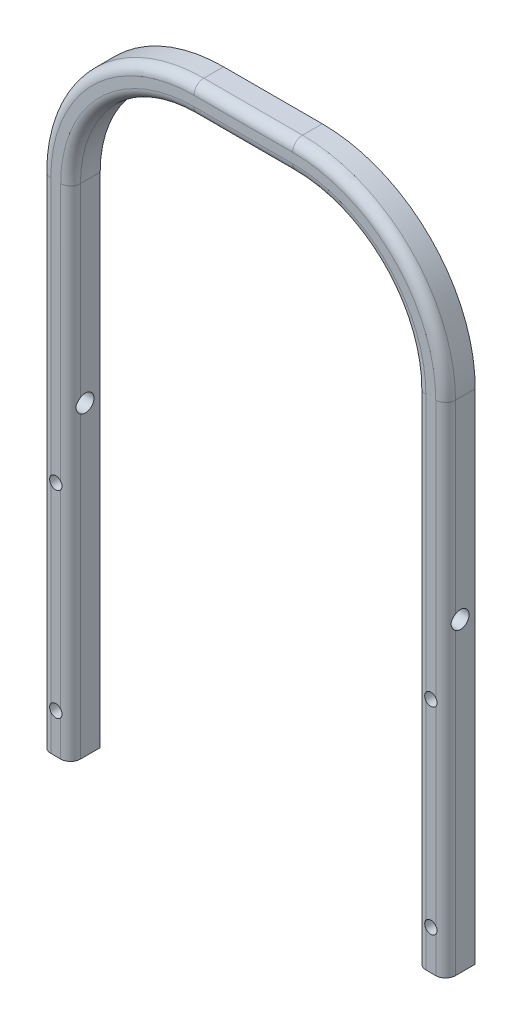
from build123d import *

# Parameters (mm, degrees)
BOSS_EXTRU_1_DEPTH           = 6
ENL_V_MAT_EXTRU_1_DEPTH      = 139.351002888
ENL_V_MAT_EXTRU_1_DEPTH_BACK = 139.351002888
ESQUISSE2_R                  = 1.25
CONG_1_R                     = 25
CONG_2_R                     = 31
CONG_3_R                     = 2
ENL_V_MAT_EXTRU_2_DEPTH      = 156.512057552
ENL_V_MAT_EXTRU_2_DEPTH_BACK = 156.512057552
ESQUISSE3_R                  = 1.75


with BuildPart() as part:
    # Esquisse1 → Boss.-Extru.1 (new body)
    with BuildSketch(Plane.XY):
        Polygon((35, 0), (35, 126), (-35, 126), (-35, 0), (-41, 0), (-41, 132), (41, 132), (41, 0), align=None)
    extrude(amount=BOSS_EXTRU_1_DEPTH)

    # Esquisse2 → Enlèv. mat.-Extru.1 (cut, two sides: drawn at the far end of the back side and taken through both)
    with BuildSketch(Plane.XY.offset(6).offset(-ENL_V_MAT_EXTRU_1_DEPTH_BACK)):
        with Locations((-38, 48)):
            Circle(ESQUISSE2_R)
        with Locations((-38, 8)):
            Circle(ESQUISSE2_R)
        with Locations((38, 8)):
            Circle(ESQUISSE2_R)
        with Locations((38, 48)):
            Circle(ESQUISSE2_R)
    extrude(amount=ENL_V_MAT_EXTRU_1_DEPTH + ENL_V_MAT_EXTRU_1_DEPTH_BACK, mode=Mode.SUBTRACT)

    # Congé1
    cong_1_edges = [part.edges().sort_by_distance(p)[0] for p in [
        (35, 126, 3),
        (-35, 126, 3),
    ]]
    fillet(cong_1_edges, radius=CONG_1_R)

    # Congé2
    cong_2_edges = [part.edges().sort_by_distance(p)[0] for p in [
        (-41, 132, 3),
        (41, 132, 3),
    ]]
    fillet(cong_2_edges, radius=CONG_2_R)

    # Congé3
    # the kernel refuses this fillet: 2 mm, written as the material it takes off along each edge
    with BuildSketch(Plane(origin=(-35, 101, 6), x_dir=(0, 0, -1), z_dir=(0, -1, 0)), Plane(origin=(35, -5, 6), x_dir=(0, 0, -1), z_dir=(0, 1, 0)), Plane(origin=(-41, -5, 6), x_dir=(0, 0, -1), z_dir=(0, 1, 0)), Plane(origin=(41, 101, 6), x_dir=(0, 0, -1), z_dir=(0, -1, 0))) as cong_3_piece_1:
        with BuildLine():
            CenterArc((CONG_3_R, -CONG_3_R), CONG_3_R, 90, 90)
            Line((0, -CONG_3_R), (0, 0))
            Line((0, 0), (CONG_3_R, 0))
        make_face()
    extrude(amount=106, mode=Mode.SUBTRACT)
    with BuildSketch(Plane(origin=(10, 126, 6), x_dir=(0, 0, -1), z_dir=(-1, 0, 0)), Plane(origin=(-10, 132, 6), x_dir=(0, 0, -1), z_dir=(1, 0, 0))) as cong_3_piece_2:
        with BuildLine():
            CenterArc((CONG_3_R, -CONG_3_R), CONG_3_R, 90, 90)
            Line((0, -CONG_3_R), (0, 0))
            Line((0, 0), (CONG_3_R, 0))
        make_face()
    extrude(amount=20, mode=Mode.SUBTRACT)
    with BuildSketch(Plane(origin=(10, 101, 6), x_dir=(1, 0, 0), z_dir=(0, -1, 0))) as cong_3_piece_3:
        with BuildLine():
            CenterArc((25 + CONG_3_R, -CONG_3_R), CONG_3_R, 90, 90)
            Line((25 + CONG_3_R, 0), (25, 0))
            Line((25, 0), (25, -CONG_3_R))
        make_face()
    revolve(axis=Axis((10, 101, 6), (0, 0, 1)), revolution_arc=90, mode=Mode.SUBTRACT)
    with BuildSketch(Plane(origin=(-10, 101, 6), x_dir=(0, 1, 0), z_dir=(1, 0, 0))) as cong_3_piece_4:
        with BuildLine():
            CenterArc((25 + CONG_3_R, -CONG_3_R), CONG_3_R, 90, 90)
            Line((25 + CONG_3_R, 0), (25, 0))
            Line((25, 0), (25, -CONG_3_R))
        make_face()
    revolve(axis=Axis((-10, 101, 6), (0, 0, 1)), revolution_arc=90, mode=Mode.SUBTRACT)
    with BuildSketch(Plane(origin=(-10, 101, 6), x_dir=(0, 1, 0), z_dir=(1, 0, 0))) as cong_3_piece_5:
        with BuildLine():
            CenterArc((31 - CONG_3_R, -CONG_3_R), CONG_3_R, 0, 90)
            Line((31 - CONG_3_R, 0), (31, 0))
            Line((31, 0), (31, -CONG_3_R))
        make_face()
    revolve(axis=Axis((-10, 101, 6), (0, 0, 1)), revolution_arc=90, mode=Mode.SUBTRACT)
    with BuildSketch(Plane(origin=(10, 101, 6), x_dir=(1, 0, 0), z_dir=(0, -1, 0))) as cong_3_piece_6:
        with BuildLine():
            CenterArc((31 - CONG_3_R, -CONG_3_R), CONG_3_R, 0, 90)
            Line((31 - CONG_3_R, 0), (31, 0))
            Line((31, 0), (31, -CONG_3_R))
        make_face()
    revolve(axis=Axis((10, 101, 6), (0, 0, 1)), revolution_arc=90, mode=Mode.SUBTRACT)

    # Esquisse3 → Enlèv. mat.-Extru.2 (cut, two sides: drawn at the far end of the back side and taken through both)
    with BuildSketch(Plane(origin=(41, 0, 0), x_dir=(0, 0, -1), z_dir=(1, 0, 0)).offset(-ENL_V_MAT_EXTRU_2_DEPTH_BACK)):
        with Locations(Location((-3, 62, 0), (0, 0, 124.849904579))):
            Circle(ESQUISSE3_R)
    extrude(amount=ENL_V_MAT_EXTRU_2_DEPTH + ENL_V_MAT_EXTRU_2_DEPTH_BACK, mode=Mode.SUBTRACT)


solid = part.part
